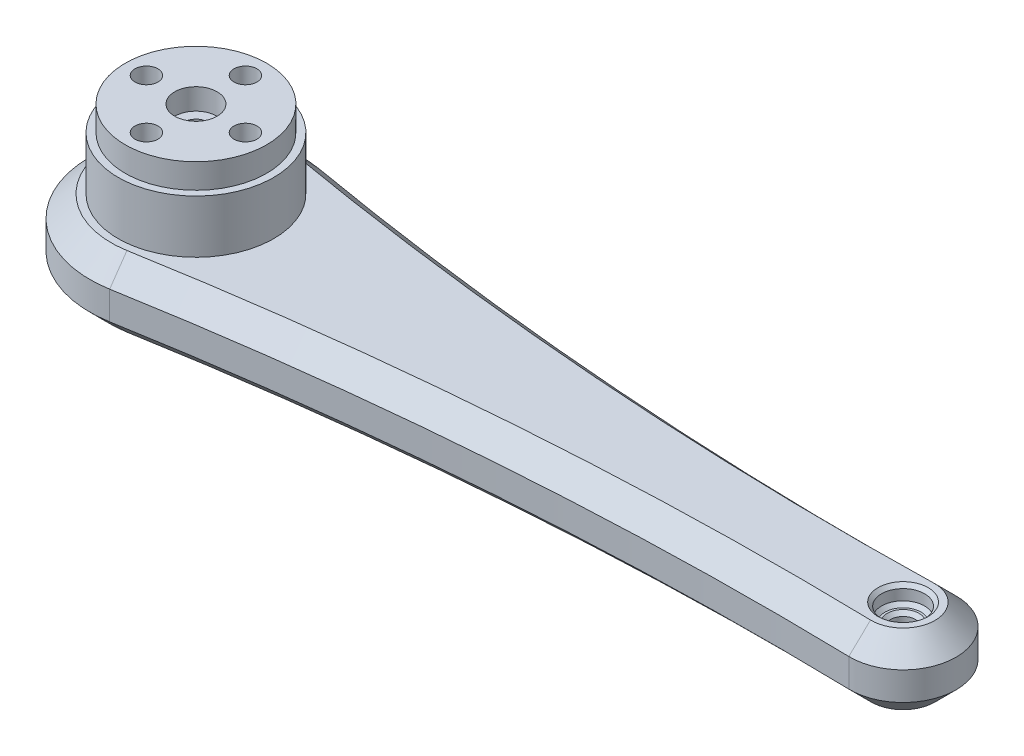
from build123d import *

# Parameters (mm, degrees)
ESQUISSE1_R                = 10
ESQUISSE1_R_2              = 1.625
BOSS_EXTRU_1_DEPTH         = 21
ESQUISSE2_R                = 3
ENL_V_MAT_EXTRU_1_DEPTH    = 3
BOSS_EXTRU_2_START         = 21
ESQUISSE3_R                = 11
ESQUISSE3_R_2              = 10
BOSS_EXTRU_2_DEPTH         = 17.5
ESQUISSE4_R                = 11
BOSS_EXTRU_3_DEPTH         = 10
ESQUISSE5_R                = 3.045
ENL_V_MAT_EXTRU_2_DEPTH    = 2.5
ESQUISSE6_R                = 1.75
ENL_V_MAT_EXTRU_3_DEPTH    = 111.106766368
CHANFREIN1_SIZE            = 3
PER_AGEAVANC_2_OUTLINE_R   = 3.25
PER_AGEAVANC_2_OUTLINE_R_2 = 1.625
PER_AGEAVANC_2_DEPTH       = 4
CHANFREIN2_SIZE            = 0.5


# Read off the part's stored shape, not the designer's step: PerçageAvancé2
with BuildPart() as part:
    # Esquisse1 → Boss.-Extru.1 (new body)
    with BuildSketch(Plane(origin=(0, 0, 0), x_dir=(1, 0, 0), z_dir=(0, 1, 0))):
        with Locations(Location((0, 0, 0), (0, 0, 90))):
            Circle(ESQUISSE1_R)
        with Locations(Location((0, 7, 0), (0, 0, 90))):
            Circle(ESQUISSE1_R_2, mode=Mode.SUBTRACT)
        with Locations(Location((7, 0, 0), (0, 0, 90))):
            Circle(ESQUISSE1_R_2, mode=Mode.SUBTRACT)
        with Locations(Location((0, -7, 0), (0, 0, 90))):
            Circle(ESQUISSE1_R_2, mode=Mode.SUBTRACT)
        with Locations(Location((-7, 0, 0), (0, 0, 90))):
            Circle(ESQUISSE1_R_2, mode=Mode.SUBTRACT)
        with Locations(Location((0, 0, 0), (0, 0, 90))):
            Circle(ESQUISSE1_R_2, mode=Mode.SUBTRACT)
    extrude(amount=BOSS_EXTRU_1_DEPTH)

    # Esquisse2 → Enlèv. mat.-Extru.1 (cut)
    with BuildSketch(Plane(origin=(0, 21, 0), x_dir=(1, 0, 0), z_dir=(0, 1, 0))):
        with Locations(Location((0, 0, 0), (0, 0, 270))):
            Circle(ESQUISSE2_R)
    extrude(amount=-ENL_V_MAT_EXTRU_1_DEPTH, mode=Mode.SUBTRACT)

    # Esquisse3 → Boss.-Extru.2 (add)
    with BuildSketch(Plane.XZ.offset(-21).offset(BOSS_EXTRU_2_START)):
        with Locations(Location((0, 0, 0), (0, 0, 90))):
            Circle(ESQUISSE3_R)
        with Locations(Location((0, 0, 0), (0, 0, 270))):
            Circle(ESQUISSE3_R_2, mode=Mode.SUBTRACT)
    extrude(amount=-BOSS_EXTRU_2_DEPTH)

    # Esquisse4 → Boss.-Extru.3 (add)
    with BuildSketch(Plane.XZ):
        with BuildLine():
            ThreePointArc((2.57876462, 14.77666989), (-15, 0), (2.57876462, -14.77666989))
            ThreePointArc((2.57876462, -14.77666989), (51.023205541, -8.75124585), (99.824833086, -7.497954158))
            ThreePointArc((99.824833086, -7.497954158), (107.5, 0), (99.824833086, 7.497954158))
            ThreePointArc((99.824833086, 7.497954158), (51.023205541, 8.75124585), (2.57876462, 14.77666989))
        make_face()
        with Locations(Location((0, 0, 0), (0, 0, 270))):
            Circle(ESQUISSE4_R, mode=Mode.SUBTRACT)
    extrude(amount=-BOSS_EXTRU_3_DEPTH)

    # Esquisse5 → Enlèv. mat.-Extru.2 (cut)
    with BuildSketch(Plane.XZ):
        with Locations(Location((100, 0, 0), (0, 0, 270))):
            Circle(ESQUISSE5_R)
    enl_v_mat_extru_2 = extrude(amount=-ENL_V_MAT_EXTRU_2_DEPTH, mode=Mode.SUBTRACT)

    # Symétrie1: Enlèv. mat.-Extru.2 across plane
    add(enl_v_mat_extru_2.mirror(Plane(origin=(0, 5, 0), x_dir=(0, 0, 1), z_dir=(0, -1, 0))), mode=Mode.SUBTRACT)

    # Esquisse6 → Enlèv. mat.-Extru.3 (cut, through all)
    with BuildSketch(Plane.XZ.offset(-2.5)):
        with Locations(Location((100, 0, 0), (0, 0, 270))):
            Circle(ESQUISSE6_R)
    extrude(amount=-ENL_V_MAT_EXTRU_3_DEPTH, mode=Mode.SUBTRACT)

    # Chanfrein1
    chanfrein1_edges = [part.edges().sort_by_distance(p)[0] for p in [
        (107.5, 10, 0),
        (51.023205541, 10, -8.75124585),
        (-15, 10, 0),
        (51.023205541, 0, 8.75124585),
        (51.023205541, 10, 8.75124585),
        (107.5, 0, 0),
        (-15, 0, 0),
        (51.023205541, 0, -8.75124585),
    ]]
    chamfer(chanfrein1_edges, length=CHANFREIN1_SIZE)

    # PerçageAvancé2 outline → PerçageAvancé2 (cut)
    # profile 1 of 4: a face of its own
    with BuildSketch(Plane(origin=(0, 0, 0), x_dir=(1, 0, 0), z_dir=(0, 1, 0))):
        with Locations((-7, 0)):
            Circle(PER_AGEAVANC_2_OUTLINE_R)
        with Locations((-7, 0)):
            Circle(PER_AGEAVANC_2_OUTLINE_R_2, mode=Mode.SUBTRACT)
    # profile 2 of 4: a face of its own
    with BuildSketch(Plane(origin=(0, 0, 0), x_dir=(1, 0, 0), z_dir=(0, 1, 0))):
        with Locations((0, 7)):
            Circle(PER_AGEAVANC_2_OUTLINE_R)
        with Locations((0, 7)):
            Circle(PER_AGEAVANC_2_OUTLINE_R_2, mode=Mode.SUBTRACT)
    # profile 3 of 4: a face of its own
    with BuildSketch(Plane(origin=(0, 0, 0), x_dir=(1, 0, 0), z_dir=(0, 1, 0))):
        with Locations((0, -7)):
            Circle(PER_AGEAVANC_2_OUTLINE_R)
        with Locations((0, -7)):
            Circle(PER_AGEAVANC_2_OUTLINE_R_2, mode=Mode.SUBTRACT)
    # profile 4 of 4: a face of its own
    with BuildSketch(Plane(origin=(0, 0, 0), x_dir=(1, 0, 0), z_dir=(0, 1, 0))):
        with Locations((7, 0)):
            Circle(PER_AGEAVANC_2_OUTLINE_R)
        with Locations((7, 0)):
            Circle(PER_AGEAVANC_2_OUTLINE_R_2, mode=Mode.SUBTRACT)
    extrude(amount=PER_AGEAVANC_2_DEPTH, mode=Mode.SUBTRACT)

    # Chanfrein2
    chanfrein2_edges = [part.edges().sort_by_distance(p)[0] for p in [
        (100, 0, 3.045),
        (100, 10, 3.045),
        (100, 7.5, 3.045),
        (100, 7.5, 1.75),
        (100, 2.5, 1.75),
    ]]
    chamfer(chanfrein2_edges, length=CHANFREIN2_SIZE)


solid = part.part
